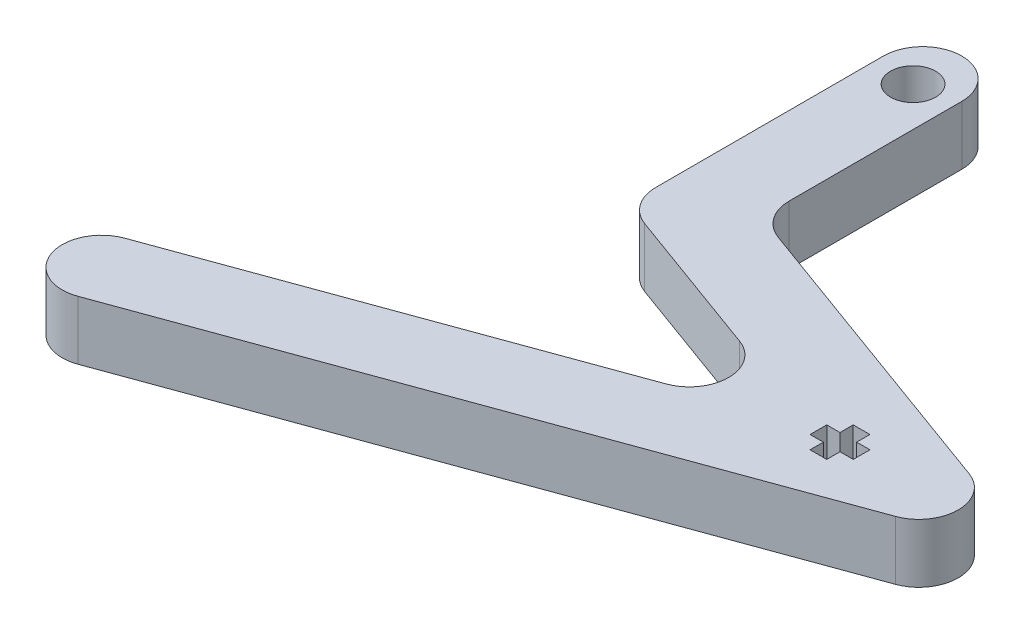
from build123d import *

# Parameters (mm, degrees)
SKETCH1_R           = 2.3
BOSS_EXTRUDE1_DEPTH = 6
FILLET1_R           = 4


with BuildPart() as part:
    # Sketch1 → Boss-Extrude1 (new body)
    with BuildSketch(Plane(origin=(0, 0, 0), x_dir=(1, 0, 0), z_dir=(0, 1, 0))):
        Polygon((-80.684780516, 38.81470852), (-80.684780516, 8.81470852), (-52.494001892, -1.44589578), (-107.0151375, -21.289966279), (-104.278976354, -28.807507246), (-29.103566691, -1.44589578), (-72.684780516, 14.416368826), (-72.684780516, 38.81470852), align=None)
        with Locations(Location((-76.684780516, 33.843739542, 0), (0, 0, 270))):
            Circle(SKETCH1_R, mode=Mode.SUBTRACT)
        Polygon((-51.010936087, -0.6288713), (-51.010936087, -2.3288713), (-49.660936087, -2.3288713), (-49.660936087, -3.6788713), (-47.960936087, -3.6788713), (-47.960936087, -2.3288713), (-46.610936087, -2.3288713), (-46.610936087, -0.6288713), (-47.960936087, -0.6288713), (-47.960936087, 0.7211287), (-49.660936087, 0.7211287), (-49.660936087, -0.6288713), align=None, mode=Mode.SUBTRACT)
    extrude(amount=BOSS_EXTRUDE1_DEPTH)

    # Fillet1
    fillet1_edges = [part.edges().sort_by_distance(p)[0] for p in [
        (-72.684780516, 3, -14.416368826),
        (-80.684780516, 3, -8.81470852),
        (-104.278976354, 3, 28.807507246),
        (-107.0151375, 3, 21.289966279),
        (-52.494001892, 3, 1.44589578),
        (-29.103566691, 3, 1.44589578),
        (-72.684780516, 3, -38.81470852),
        (-80.684780516, 3, -38.81470852),
    ]]
    fillet(fillet1_edges, radius=FILLET1_R - 0.0001)  # a hair under: the kernel refuses the full size


solid = part.part
